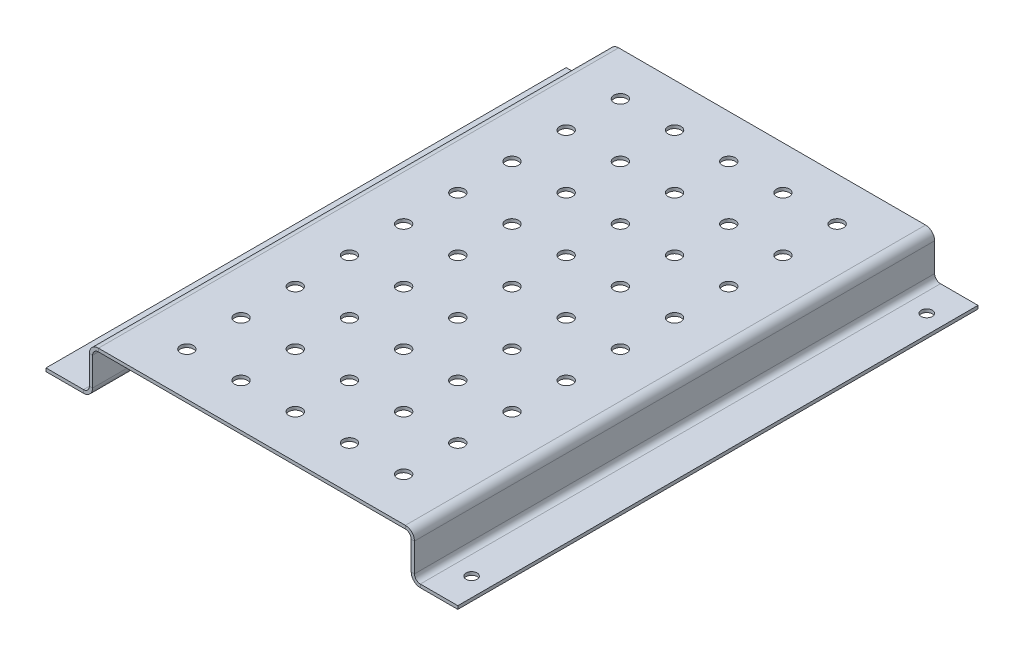
from build123d import *

# Parameters (mm, degrees)
SM_BASE_FLANGE_1_DEPTH = 120
SKETCH_6_R             = 2.55
CUT_EXTRUDE_1_DEPTH    = 10
SKETCH_7_R             = 3
CUT_EXTRUDE_2_DEPTH    = 10


# Sheet-metal steps are written as plain solids
with BuildPart() as part:
    # Sketch 1 → Базовая кромка1 (new, symmetric)
    with BuildSketch(Plane.XY):
        with BuildLine():
            Line((-95, 0), (-77.7, 0))
            ThreePointArc((-77.7, 0), (-75.790811691, 0.790811691), (-75, 2.7))
            Line((-75, 2.7), (-75, 15.8))
            ThreePointArc((-75, 15.8), (-73.769848481, 18.769848481), (-70.8, 20))
            Line((-70.8, 20), (70.8, 20))
            ThreePointArc((70.8, 20), (73.769848481, 18.769848481), (75, 15.8))
            Line((75, 15.8), (75, 2.7))
            ThreePointArc((75, 2.7), (75.790811691, 0.790811691), (77.7, 0))
            Line((77.7, 0), (95, 0))
            Line((95, 0), (95, -1.5))
            Line((95, -1.5), (77.7, -1.5))
            ThreePointArc((77.7, -1.5), (74.730151519, -0.269848481), (73.5, 2.7))
            Line((73.5, 2.7), (73.5, 15.8))
            ThreePointArc((73.5, 15.8), (72.709188309, 17.709188309), (70.8, 18.5))
            Line((70.8, 18.5), (-70.8, 18.5))
            ThreePointArc((-70.8, 18.5), (-72.709188309, 17.709188309), (-73.5, 15.8))
            Line((-73.5, 15.8), (-73.5, 2.7))
            ThreePointArc((-73.5, 2.7), (-74.730151519, -0.269848481), (-77.7, -1.5))
            Line((-77.7, -1.5), (-95, -1.5))
            Line((-95, -1.5), (-95, 0))
        make_face()
    extrude(amount=SM_BASE_FLANGE_1_DEPTH, both=True)

    # Эскиз6 → Вырез-Вытянуть1 (cut)
    with BuildSketch(Plane(origin=(0, 0, 0), x_dir=(1, 0, 0), z_dir=(0, 1, 0))):
        with Locations(Location((-86.35, 105, 0), (0, 0, 270))):
            Circle(SKETCH_6_R)
        with Locations(Location((-86.35, -105, 0), (0, 0, 180))):
            Circle(SKETCH_6_R)
        with Locations(Location((86.35, -105, 0), (0, 0, 270))):
            Circle(SKETCH_6_R)
        with Locations(Location((86.35, 105, 0), (0, 0, 180))):
            Circle(SKETCH_6_R)
    extrude(amount=-CUT_EXTRUDE_1_DEPTH, mode=Mode.SUBTRACT)

    # Эскиз7 → Вырез-Вытянуть2 (cut)
    with BuildSketch(Plane(origin=(0, 20, 0), x_dir=(1, 0, 0), z_dir=(0, 1, 0))):
        with Locations(Location((0, 0, 0), (0, 0, 270))):
            Circle(SKETCH_7_R)
        with Locations(Location((25, 0, 0), (0, 0, 270))):
            Circle(SKETCH_7_R)
        with Locations(Location((50, 0, 0), (0, 0, 270))):
            Circle(SKETCH_7_R)
        with Locations(Location((0, 25, 0), (0, 0, 270))):
            Circle(SKETCH_7_R)
        with Locations(Location((25, 25, 0), (0, 0, 270))):
            Circle(SKETCH_7_R)
        with Locations(Location((50, 25, 0), (0, 0, 270))):
            Circle(SKETCH_7_R)
        with Locations(Location((0, 50, 0), (0, 0, 270))):
            Circle(SKETCH_7_R)
        with Locations(Location((25, 50, 0), (0, 0, 270))):
            Circle(SKETCH_7_R)
        with Locations(Location((50, 50, 0), (0, 0, 270))):
            Circle(SKETCH_7_R)
        with Locations(Location((0, 75, 0), (0, 0, 270))):
            Circle(SKETCH_7_R)
        with Locations(Location((25, 75, 0), (0, 0, 270))):
            Circle(SKETCH_7_R)
        with Locations(Location((50, 75, 0), (0, 0, 270))):
            Circle(SKETCH_7_R)
        with Locations(Location((0, 100, 0), (0, 0, 270))):
            Circle(SKETCH_7_R)
        with Locations(Location((25, 100, 0), (0, 0, 270))):
            Circle(SKETCH_7_R)
        with Locations(Location((50, 100, 0), (0, 0, 270))):
            Circle(SKETCH_7_R)
        with Locations(Location((-50, 100, 0), (0, 0, 270))):
            Circle(SKETCH_7_R)
        with Locations(Location((-25, 100, 0), (0, 0, 270))):
            Circle(SKETCH_7_R)
        with Locations(Location((-50, 75, 0), (0, 0, 270))):
            Circle(SKETCH_7_R)
        with Locations(Location((-25, 75, 0), (0, 0, 270))):
            Circle(SKETCH_7_R)
        with Locations(Location((-50, 50, 0), (0, 0, 270))):
            Circle(SKETCH_7_R)
        with Locations(Location((-25, 50, 0), (0, 0, 270))):
            Circle(SKETCH_7_R)
        with Locations(Location((-50, 25, 0), (0, 0, 270))):
            Circle(SKETCH_7_R)
        with Locations(Location((-25, 25, 0), (0, 0, 270))):
            Circle(SKETCH_7_R)
        with Locations(Location((-50, 0, 0), (0, 0, 270))):
            Circle(SKETCH_7_R)
        with Locations(Location((-25, 0, 0), (0, 0, 270))):
            Circle(SKETCH_7_R)
        with Locations(Location((-25, -25, 0), (0, 0, 270))):
            Circle(SKETCH_7_R)
        with Locations(Location((-50, -25, 0), (0, 0, 270))):
            Circle(SKETCH_7_R)
        with Locations(Location((-25, -50, 0), (0, 0, 270))):
            Circle(SKETCH_7_R)
        with Locations(Location((-50, -50, 0), (0, 0, 270))):
            Circle(SKETCH_7_R)
        with Locations(Location((-25, -75, 0), (0, 0, 270))):
            Circle(SKETCH_7_R)
        with Locations(Location((-50, -75, 0), (0, 0, 270))):
            Circle(SKETCH_7_R)
        with Locations(Location((-25, -100, 0), (0, 0, 270))):
            Circle(SKETCH_7_R)
        with Locations(Location((-50, -100, 0), (0, 0, 270))):
            Circle(SKETCH_7_R)
        with Locations(Location((50, -100, 0), (0, 0, 270))):
            Circle(SKETCH_7_R)
        with Locations(Location((25, -100, 0), (0, 0, 270))):
            Circle(SKETCH_7_R)
        with Locations(Location((0, -100, 0), (0, 0, 270))):
            Circle(SKETCH_7_R)
        with Locations(Location((50, -75, 0), (0, 0, 270))):
            Circle(SKETCH_7_R)
        with Locations(Location((25, -75, 0), (0, 0, 270))):
            Circle(SKETCH_7_R)
        with Locations(Location((0, -75, 0), (0, 0, 270))):
            Circle(SKETCH_7_R)
        with Locations(Location((50, -50, 0), (0, 0, 270))):
            Circle(SKETCH_7_R)
        with Locations(Location((25, -50, 0), (0, 0, 270))):
            Circle(SKETCH_7_R)
        with Locations(Location((0, -50, 0), (0, 0, 270))):
            Circle(SKETCH_7_R)
        with Locations(Location((50, -25, 0), (0, 0, 270))):
            Circle(SKETCH_7_R)
        with Locations(Location((25, -25, 0), (0, 0, 270))):
            Circle(SKETCH_7_R)
        with Locations(Location((0, -25, 0), (0, 0, 270))):
            Circle(SKETCH_7_R)
    extrude(amount=-CUT_EXTRUDE_2_DEPTH, mode=Mode.SUBTRACT)


solid = part.part
